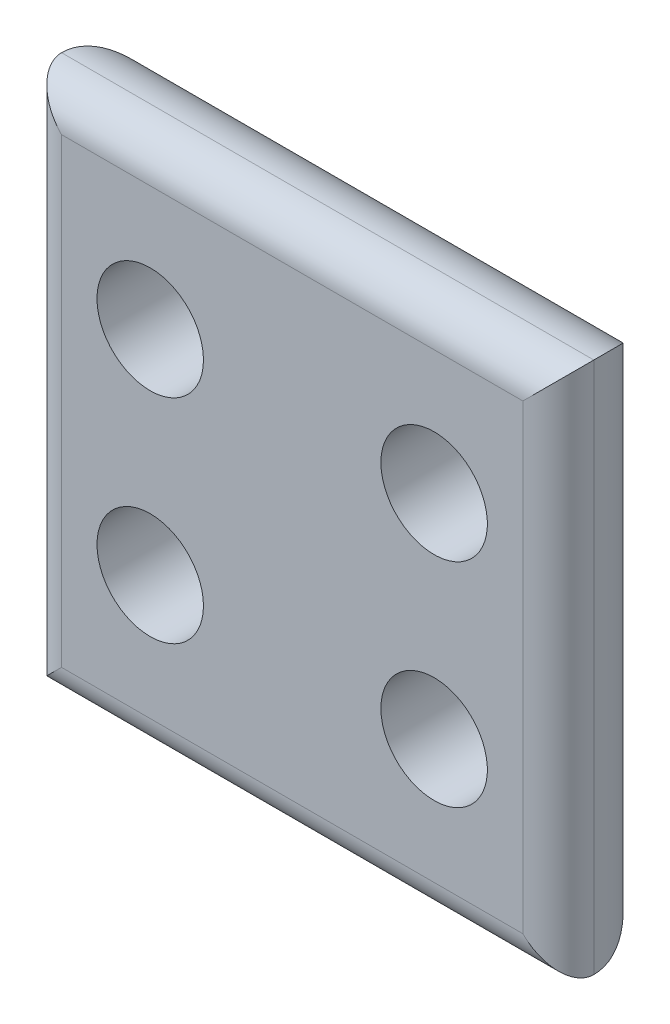
from build123d import *

# Parameters (mm, degrees)
SKETCH1_W           = 15
SKETCH1_H           = 15
SKETCH1_R           = 1.5
BOSS_EXTRUDE1_DEPTH = 3
FILLET3_R           = 1
FILLET4_R           = 2


with BuildPart() as part:
    # Sketch1 → Boss-Extrude1 (new body)
    with BuildSketch(Plane.XY):
        Rectangle(SKETCH1_W, SKETCH1_H)
        with Locations((-4, 3)):
            Circle(SKETCH1_R, mode=Mode.SUBTRACT)
        with Locations((-4, -3)):
            Circle(SKETCH1_R, mode=Mode.SUBTRACT)
        with Locations(Location((4, -3, 0), (0, 0, 180))):
            Circle(SKETCH1_R, mode=Mode.SUBTRACT)
        with Locations(Location((4, 3, 0), (0, 0, 180))):
            Circle(SKETCH1_R, mode=Mode.SUBTRACT)
    extrude(amount=BOSS_EXTRUDE1_DEPTH)

    # Fillet3
    fillet3_edges = [part.edges().sort_by_distance(p)[0] for p in [
        (-7.5, 0, 3),
        (0, -7.5, 3),
        (7.5, 0, 3),
        (0, 7.5, 3),
    ]]
    fillet(fillet3_edges, radius=FILLET3_R)

    # Fillet4
    fillet4_edges = [part.edges().sort_by_distance(p)[0] for p in [
        (0, -7.5, 0),
        (-7.5, 0, 0),
        (7.5, 0, 0),
        (0, 7.5, 0),
    ]]
    fillet(fillet4_edges, radius=FILLET4_R - 0.0001)  # a hair under: the kernel refuses the full size


solid = part.part
